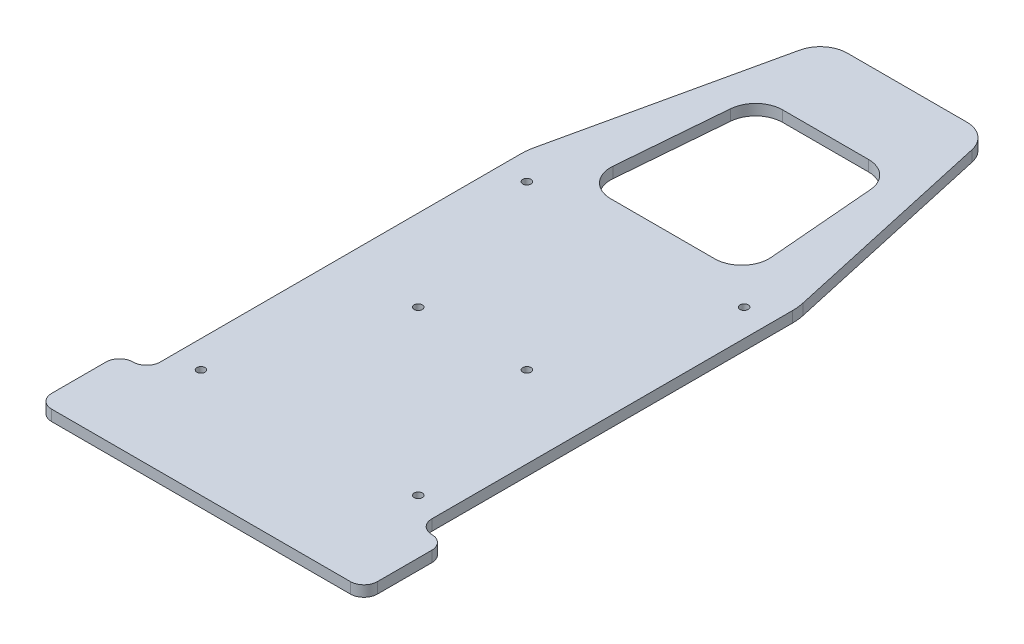
from build123d import *

# Parameters (mm, degrees)
SKETCH_1_R      = 1.5
EXTRUDE_1_DEPTH = 4
FILLET_1_R      = 5
FILLET_2_R      = 20
FILLET_3_R      = 10
FILLET_4_R      = 10


with BuildPart() as part:
    # Эскиз1 → Бобышка-Вытянуть1 (new body)
    with BuildSketch(Plane(origin=(0, 0, 0), x_dir=(1, 0, 0), z_dir=(0, 1, 0))):
        Polygon((341.185276631, -307.117267335), (341.185276631, -167.117267335), (361.185276631, -77.117267335), (421.185276631, -77.117267335), (441.185276631, -167.117267335), (441.185276631, -307.117267335), (451.185276631, -307.117267335), (451.185276631, -337.117267335), (391.185276631, -337.117267335), (331.185276631, -337.117267335), (331.185276631, -307.117267335), align=None)
        with Locations(Location((351.185276631, -177.117267335, 0), (0, 0, 270))):
            Circle(SKETCH_1_R, mode=Mode.SUBTRACT)
        with Locations(Location((431.185276631, -177.117267335, 0), (0, 0, 270))):
            Circle(SKETCH_1_R, mode=Mode.SUBTRACT)
        with Locations(Location((431.185276631, -297.117267335, 0), (0, 0, 270))):
            Circle(SKETCH_1_R, mode=Mode.SUBTRACT)
        with Locations(Location((351.185276631, -297.117267335, 0), (0, 0, 270))):
            Circle(SKETCH_1_R, mode=Mode.SUBTRACT)
        with Locations(Location((371.185276631, -237.117267335, 0), (0, 0, 270))):
            Circle(SKETCH_1_R, mode=Mode.SUBTRACT)
        with Locations(Location((411.185276631, -237.117267335, 0), (0, 0, 270))):
            Circle(SKETCH_1_R, mode=Mode.SUBTRACT)
        Polygon((361.185276631, -167.117267335), (366.185276631, -107.117267335), (416.185276631, -107.117267335), (421.185276631, -167.117267335), align=None, mode=Mode.SUBTRACT)
    extrude(amount=EXTRUDE_1_DEPTH)

    # Скругление1
    fillet_1_edges = [part.edges().sort_by_distance(p)[0] for p in [
        (441.185276631, 2, 307.117267335),
        (341.185276631, 2, 307.117267335),
        (331.185276631, 2, 307.117267335),
        (331.185276631, 2, 337.117267335),
        (451.185276631, 2, 337.117267335),
        (451.185276631, 2, 307.117267335),
    ]]
    fillet(fillet_1_edges, radius=FILLET_1_R - 0.0001)  # a hair under: the kernel refuses the full size

    # Скругление2
    fillet_2_edges = [part.edges().sort_by_distance(p)[0] for p in [
        (441.185276631, 2, 167.117267335),
        (341.185276631, 2, 167.117267335),
    ]]
    fillet(fillet_2_edges, radius=FILLET_2_R)

    # Скругление3
    fillet_3_edges = [part.edges().sort_by_distance(p)[0] for p in [
        (416.185276631, 2, 107.117267335),
        (366.185276631, 2, 107.117267335),
        (361.185276631, 2, 167.117267335),
        (421.185276631, 2, 167.117267335),
    ]]
    fillet(fillet_3_edges, radius=FILLET_3_R)

    # Скругление4
    fillet_4_edges = [part.edges().sort_by_distance(p)[0] for p in [
        (361.185276631, 2, 77.117267335),
        (421.185276631, 2, 77.117267335),
    ]]
    fillet(fillet_4_edges, radius=FILLET_4_R)


solid = part.part
